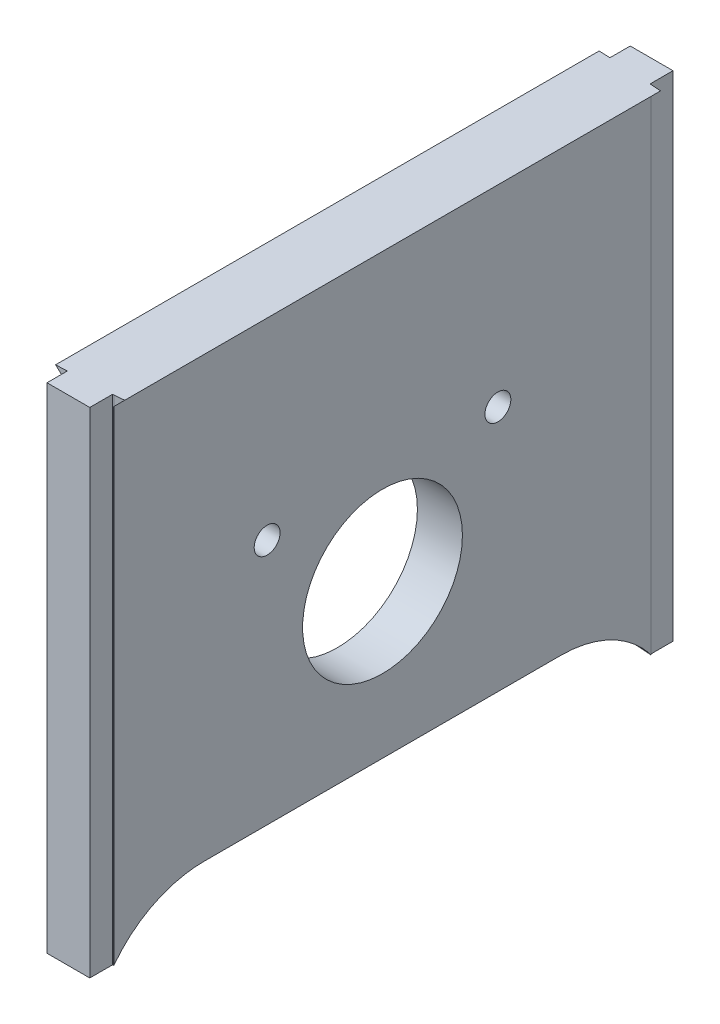
from build123d import *
from build123d.topology import SkipClean

# Parameters (mm, degrees)
SKETCH1_R                = 4.1
SKETCH1_R_2              = 1.15
BOSS_EXTRUDE1_DEPTH      = 3.5
BOSS_EXTRUDE2_DEPTH      = 67.25
CUT_EXTRUDE1_DEPTH       = 94.994268442
SKETCH4_W                = 26.5
SKETCH4_H                = 47.25
CUT_EXTRUDE2_DEPTH       = 3.5
SKETCH6_W                = 31.5
SKETCH6_H                = 52.25
BOSS_EXTRUDE3_DEPTH      = 2
CHAMFER2_SIZE            = 2
SKETCH7_W                = 26.5
SKETCH7_H                = 47.25
CUT_EXTRUDE3_DEPTH       = 0.8
CUT_EXTRUDE4_REACH       = 97.271
SKETCH8_W                = 21.401119101
SKETCH8_H                = 6.5
CUT_EXTRUDE5_REACH       = 97.271
SKETCH9_R                = 7.1
BOSS_EXTRUDE4_DEPTH      = 3.5
SKETCH11_W               = 4
SKETCH11_H               = 49.717369648
BOSS_EXTRUDE5_DEPTH      = 40
SKETCH12_R               = 7.1
CUT_EXTRUDE6_DEPTH       = 10
CHAMFER3_SIZE            = 1
CHAMFER4_SIZE            = 1
SKETCH13_R               = 9
SKETCH13_R_2             = 5.5
BOSS_EXTRUDE6_DEPTH      = 1.5
SKETCH16_R               = 9
BOSS_EXTRUDE7_DEPTH      = 1
FILLET2_R                = 1
SKETCH18_R               = 9
SKETCH18_R_2             = 7.1
BOSS_EXTRUDE8_DEPTH      = 0.5
CHAMFER5_SIZE            = 0.5
BOSS_EXTRUDE9_DEPTH      = 40.5
CUT_EXTRUDE8_REACH       = 129.458
CHAMFER6_SIZE            = 1.5
CUT_EXTRUDE9_REACH       = 129.458
SKETCH20_R               = 7.1
SKETCH21_R               = 1.5
BOSS_EXTRUDE10_DEPTH     = 3.5
CUT_EXTRUDE10_REACH      = 129.458
SKETCH22_R               = 3.75
SKETCH23_R               = 1.15
BOSS_EXTRUDE11_DEPTH     = 1.82
BOSS_EXTRUDE12_START     = 2.65
SKETCH24_W               = 5
SKETCH24_H               = 15.934069979
SKETCH24_R               = 1.15
BOSS_EXTRUDE12_DEPTH     = 2.65
CUT_EXTRUDE11_REACH      = 118.561
SKETCH25_R               = 1.15
SKETCH26_R               = 13.375
CUT_EXTRUDE12_DEPTH      = 3.3
SKETCH27_R               = 5
BOSS_EXTRUDE13_DEPTH     = 1
FILLET7_R                = 0.75
SKETCH28_R               = 8
SKETCH28_R_2             = 4.1
BOSS_EXTRUDE14_DEPTH     = 1.5
SKETCH29_R               = 8
SKETCH29_R_2             = 4.1
BOSS_EXTRUDE15_DEPTH     = 8.5
CUT_EXTRUDE13_DEPTH      = 15
CUT_EXTRUDE13_DEPTH_BACK = 127.447026853
SKETCH30_R               = 1.125
SKETCH31_R               = 7.1
BOSS_EXTRUDE16_DEPTH     = 0.5
CHAMFER7_SIZE            = 0.5
CHAMFER7_OF_MIRROR5_SIZE = 0.5
FILLET8_R                = 2.5
CUT_EXTRUDE14_DEPTH      = 10
CUT_EXTRUDE14_DEPTH_BACK = 10
SKETCH32_W               = 30.5
SKETCH32_H               = 23.22
FILLET9_R                = 5
CUT_EXTRUDE15_DEPTH      = 2
SKETCH34_R               = 2.25
CUT_EXTRUDE16_DEPTH      = 1.5
CUT_EXTRUDE17_DEPTH      = 133.651095359
CUT_EXTRUDE17_DEPTH_BACK = 2
SKETCH35_W               = 15
SKETCH35_H               = 21.75
FILLET10_R               = 1
FILLET11_R               = 1
SKETCH36_R               = 1.15
CUT_EXTRUDE18_DEPTH      = 127.188133357
CUT_EXTRUDE24_DEPTH      = 107.374679788
CUT_EXTRUDE24_DEPTH_BACK = 107.374679788
SKETCH39_W               = 129.097632358
SKETCH39_H               = 90.611923089
CUT_EXTRUDE25_DEPTH      = 69.011167635
CUT_EXTRUDE25_DEPTH_BACK = 3.5
SKETCH40_W               = 54.925006482
SKETCH40_H               = 71.748882342
CUT_EXTRUDE26_DEPTH      = 66.567961717
FILLET12_R               = 10
CUT_EXTRUDE27_DEPTH      = 0.1
FILLET13_R               = 0.02


# Some blends are built 0.0001 mm under size
with BuildPart() as part:
    # Sketch1 → Boss-Extrude1 (new body)
    with BuildSketch(Plane(origin=(0, 0, 0), x_dir=(0, 0, -1), z_dir=(1, 0, 0))):
        with BuildLine():
            Line((-17.25, 0), (-17.25, -67.25))
            Line((-17.25, -67.25), (17.25, -67.25))
            Line((17.25, -67.25), (17.25, 0))
            ThreePointArc((17.25, 0), (0, 17.25), (-17.25, 0))
        make_face()
        Circle(SKETCH1_R, mode=Mode.SUBTRACT)
        with Locations((0, 8.125)):
            Circle(SKETCH1_R_2, mode=Mode.SUBTRACT)
        with Locations((8.125, 0)):
            Circle(SKETCH1_R_2, mode=Mode.SUBTRACT)
        with Locations((-8.125, 0)):
            Circle(SKETCH1_R_2, mode=Mode.SUBTRACT)
        with Locations((0, -8.125)):
            Circle(SKETCH1_R_2, mode=Mode.SUBTRACT)
    boss_extrude1 = extrude(amount=BOSS_EXTRUDE1_DEPTH)

    # Sketch2 → Boss-Extrude2 (add)
    with BuildSketch(Plane(origin=(0, 0, 0), x_dir=(-1, 0, 0), z_dir=(0, -1, 0))):
        with BuildLine():
            Line((-59.4, -17.25), (-59.4, -20.25))
            ThreePointArc((-59.4, -20.25), (-58.989582055, -21.693064324), (-58.079872716, -22.886088403))
            ThreePointArc((-58.079872716, -22.886088403), (-54.454905265, -25.285822393), (-50.289145158, -26.529025904))
            ThreePointArc((-50.289145158, -26.529025904), (-40.020812264, -27.631788405), (-29.7, -28))
            ThreePointArc((-29.7, -28), (-19.379187736, -27.631788405), (-9.110854842, -26.529025904))
            ThreePointArc((-9.110854842, -26.529025904), (-4.945094735, -25.285822393), (-1.320127284, -22.886088403))
            ThreePointArc((-1.320127284, -22.886088403), (-0.410417945, -21.693064324), (0, -20.25))
            Line((0, -20.25), (0, -17.25))
            Line((0, -17.25), (-3.5, -17.25))
            Line((-3.5, -17.25), (-3.735903774, -19.954735321))
            ThreePointArc((-3.735903774, -19.954735321), (-3.770225997, -20.037754997), (-3.828562802, -20.106071165))
            ThreePointArc((-3.828562802, -20.106071165), (-6.407189742, -21.835001354), (-9.364778442, -22.779027613))
            ThreePointArc((-9.364778442, -22.779027613), (-19.505740765, -23.883479028), (-29.7, -24.2522722))
            ThreePointArc((-29.7, -24.2522722), (-39.894259235, -23.883479028), (-50.035221558, -22.779027613))
            ThreePointArc((-50.035221558, -22.779027613), (-52.992810258, -21.835001354), (-55.571437198, -20.106071165))
            ThreePointArc((-55.571437198, -20.106071165), (-55.629774003, -20.037754997), (-55.664096226, -19.954735321))
            Line((-55.664096226, -19.954735321), (-55.9, -17.25))
            Line((-55.9, -17.25), (-59.4, -17.25))
        make_face()
    boss_extrude2 = extrude(amount=BOSS_EXTRUDE2_DEPTH)

    # Mirror2: Boss-Extrude1 across plane
    add(boss_extrude1.mirror(Plane.ZY.offset(-29.7)))

    # Sketch3 → Cut-Extrude1 (cut, through all)
    with BuildSketch(Plane.ZY):
        Polygon((17.25, 0), (32.748612496, -8.948128097), (32.748612496, 0), align=None)
    cut_extrude1 = extrude(amount=-CUT_EXTRUDE1_DEPTH, mode=Mode.SUBTRACT)

    # Mirror3: Boss-Extrude2, Cut-Extrude1 across plane
    add(boss_extrude2.mirror(Plane(origin=(0, 0, 0), x_dir=(1, 0, 0), z_dir=(0, 0, -1))))
    add(cut_extrude1.mirror(Plane(origin=(0, 0, 0), x_dir=(1, 0, 0), z_dir=(0, 0, -1))), mode=Mode.SUBTRACT)

    # Sketch4 → Cut-Extrude2 (cut)
    with BuildSketch(Plane.ZY):
        with Locations((0, -37.125)):
            Rectangle(SKETCH4_W, SKETCH4_H)
    extrude(amount=-CUT_EXTRUDE2_DEPTH, mode=Mode.SUBTRACT)

    # Sketch6 → Boss-Extrude3 (add)
    with BuildSketch(Plane.ZY):
        with Locations((0, -37.125)):
            Rectangle(SKETCH6_W, SKETCH6_H)
    extrude(amount=BOSS_EXTRUDE3_DEPTH)

    # Chamfer2
    chamfer2_edges = [part.edges().sort_by_distance(p)[0] for p in [
        (-2, -63.25, 0),
        (-2, -37.125, 15.75),
        (-2, -37.125, -15.75),
        (-2, -11, 0),
    ]]
    chamfer(chamfer2_edges, length=CHAMFER2_SIZE - 0.0001)  # a hair under: the kernel refuses the full size

    # Sketch7 → Cut-Extrude3 (cut)
    with BuildSketch(Plane(origin=(0, 0, 0), x_dir=(0, 0, -1), z_dir=(1, 0, 0))):
        with Locations((0, -37.125)):
            Rectangle(SKETCH7_W, SKETCH7_H)
    extrude(amount=-CUT_EXTRUDE3_DEPTH, mode=Mode.SUBTRACT)

    # Sketch8 → Cut-Extrude4 (cut, up to next)
    with BuildSketch(Plane.ZY.offset(2), mode=Mode.PRIVATE) as cut_extrude4_sk1:
        with Locations((0.049440449, -35.5)):
            Rectangle(SKETCH8_W, SKETCH8_H)
    cut_extrude4_tool1 = extrude(cut_extrude4_sk1.sketch, amount=-CUT_EXTRUDE4_REACH, mode=Mode.PRIVATE) & part.part
    add(cut_extrude4_tool1.solids().sort_by_distance((-2, -35.5, 0.04944))[0], mode=Mode.SUBTRACT)

    # Sketch9 → Cut-Extrude5 (cut, up to next)
    with BuildSketch(Plane(origin=(59.4, 0, 0), x_dir=(0, 0, -1), z_dir=(1, 0, 0)), mode=Mode.PRIVATE) as cut_extrude5_sk1:
        with Locations((0, -49.64)):
            Circle(SKETCH9_R)
    cut_extrude5_tool1 = extrude(cut_extrude5_sk1.sketch, amount=-CUT_EXTRUDE5_REACH, mode=Mode.PRIVATE) & part.part
    add(cut_extrude5_tool1.solids().sort_by_distance((59.4, -49.64, 0))[0], mode=Mode.SUBTRACT)

    # Sketch10 → Boss-Extrude4 (add)
    with BuildSketch(Plane(origin=(0, -19.75, 0), x_dir=(-1, 0, 0), z_dir=(0, -1, 0))):
        with BuildLine():
            Line((-55.664096226, -19.954735321), (-55.9, -17.25))
            Line((-55.9, -17.25), (-55.9, 17.25))
            Line((-55.9, 17.25), (-55.664096226, 19.954735321))
            ThreePointArc((-55.664096226, 19.954735321), (-55.629774003, 20.037754997), (-55.571437198, 20.106071165))
            ThreePointArc((-55.571437198, 20.106071165), (-52.992810258, 21.835001354), (-50.035221558, 22.779027613))
            ThreePointArc((-50.035221558, 22.779027613), (-29.7, 24.2522722), (-9.364778442, 22.779027613))
            ThreePointArc((-9.364778442, 22.779027613), (-6.407189742, 21.835001354), (-3.828562802, 20.106071165))
            ThreePointArc((-3.828562802, 20.106071165), (-3.770225997, 20.037754997), (-3.735903774, 19.954735321))
            Line((-3.735903774, 19.954735321), (-3.5, 17.25))
            Line((-3.5, 17.25), (-3.5, 12.559999042))
            Line((-3.5, 12.559999042), (-34.519998723, 12.559999042))
            Line((-34.519998723, 12.559999042), (-34.519998723, -12.559999407))
            Line((-34.519998723, -12.559999407), (-3.5, -12.559999407))
            Line((-3.5, -12.559999407), (-3.5, -17.25))
            Line((-3.5, -17.25), (-3.735903774, -19.954735321))
            ThreePointArc((-3.735903774, -19.954735321), (-3.770225997, -20.037754997), (-3.828562802, -20.106071165))
            ThreePointArc((-3.828562802, -20.106071165), (-6.407189742, -21.835001354), (-9.364778442, -22.779027613))
            ThreePointArc((-9.364778442, -22.779027613), (-29.7, -24.2522722), (-50.035221558, -22.779027613))
            ThreePointArc((-50.035221558, -22.779027613), (-52.992810258, -21.835001354), (-55.571437198, -20.106071165))
            ThreePointArc((-55.571437198, -20.106071165), (-55.629774003, -20.037754997), (-55.664096226, -19.954735321))
        make_face()
    extrude(amount=BOSS_EXTRUDE4_DEPTH)

    # Sketch11 → Boss-Extrude5 (add)
    with BuildSketch(Plane(origin=(0, -23.25, 0), x_dir=(-1, 0, 0), z_dir=(0, -1, 0))):
        with Locations((-38.07, 0.750293773)):
            Rectangle(SKETCH11_W, SKETCH11_H)
    extrude(amount=BOSS_EXTRUDE5_DEPTH)

    # Sketch12 → Cut-Extrude6 (cut)
    with BuildSketch(Plane(origin=(40.07, 0, 0), x_dir=(0, 0, -1), z_dir=(1, 0, 0))):
        with Locations((0, -49.64)):
            Circle(SKETCH12_R)
    extrude(amount=-CUT_EXTRUDE6_DEPTH, mode=Mode.SUBTRACT)

    # Chamfer3
    chamfer3_edges = [part.edges().sort_by_distance(p)[0] for p in [
        (36.07, -23.25, 0),
    ]]
    chamfer(chamfer3_edges, length=CHAMFER3_SIZE)

    # Chamfer4
    chamfer4_edges = [part.edges().sort_by_distance(p)[0] for p in [
        (40.07, -23.25, 0),
    ]]
    chamfer(chamfer4_edges, length=CHAMFER4_SIZE)

    # Sketch13 → Boss-Extrude6 (add)
    with BuildSketch(Plane(origin=(59.4, 0, 0), x_dir=(0, 0, -1), z_dir=(1, 0, 0))):
        with Locations(Location((0, -49.64, 0), (0, 0, 180))):
            Circle(SKETCH13_R)
        with Locations((0, -49.64)):
            Circle(SKETCH13_R_2, mode=Mode.SUBTRACT)
    extrude(amount=BOSS_EXTRUDE6_DEPTH)

    # Sketch16 → Boss-Extrude7 (add)
    with BuildSketch(Plane(origin=(60.9, 0, 0), x_dir=(0, 0, -1), z_dir=(1, 0, 0))):
        with Locations(Location((0, -49.64, 0), (0, 0, 180))):
            Circle(SKETCH16_R)
    extrude(amount=BOSS_EXTRUDE7_DEPTH)

    # Fillet2
    fillet2_edges = [part.edges().sort_by_distance(p)[0] for p in [
        (61.9, -49.64, -9),
    ]]
    fillet(fillet2_edges, radius=FILLET2_R)

    # Sketch18 → Boss-Extrude8 (add)
    with BuildSketch(Plane.ZY.offset(-55.9)):
        with Locations((0, -49.64)):
            Circle(SKETCH18_R)
        with Locations(Location((0, -49.64, 0), (0, 0, 180))):
            Circle(SKETCH18_R_2, mode=Mode.SUBTRACT)
    extrude(amount=BOSS_EXTRUDE8_DEPTH)

    # Chamfer5
    chamfer5_edges = [part.edges().sort_by_distance(p)[0] for p in [
        (55.9, -49.64, -9),
    ]]
    chamfer(chamfer5_edges, length=CHAMFER5_SIZE - 0.0001)  # a hair under: the kernel refuses the full size

    # Sketch17 → Boss-Extrude9 (add)
    with BuildSketch(Plane(origin=(0, 0, 20.25), x_dir=(-1, 0, 0), z_dir=(0, 0, -1))):
        Polygon((-59.65, -105.91), (-63.15, -105.91), (-63.15, -67.5), (-59.4, -63.75), (-59.4, -67.25), (-55.9, -67.25), (-59.65, -71), align=None)
    boss_extrude9 = extrude(amount=BOSS_EXTRUDE9_DEPTH)

    # Sketch19 → Cut-Extrude8 (cut, up to next)
    with BuildSketch(Plane(origin=(63.15, 0, 0), x_dir=(0, 0, -1), z_dir=(1, 0, 0)), mode=Mode.PRIVATE) as cut_extrude8_sk1:
        with BuildLine():
            ThreePointArc((0, -105.91), (-12.515790027, -100.725790027), (-17.7, -88.21))
            Line((-17.7, -88.21), (-20.25, -85.66))
            Line((-20.25, -85.66), (-20.25, -105.91))
            Line((-20.25, -105.91), (0, -105.91))
        make_face()
    cut_extrude8_tool1 = extrude(cut_extrude8_sk1.sketch, amount=-CUT_EXTRUDE8_REACH, mode=Mode.PRIVATE) & part.part
    # Sketch19 → Cut-Extrude8 (cut, up to next)
    with BuildSketch(Plane(origin=(63.15, 0, 0), x_dir=(0, 0, -1), z_dir=(1, 0, 0)), mode=Mode.PRIVATE) as cut_extrude8_sk2:
        with BuildLine():
            ThreePointArc((17.7, -88.21), (12.515790027, -100.725790027), (0, -105.91))
            Line((0, -105.91), (20.25, -105.91))
            Line((20.25, -105.91), (20.25, -85.66))
            Line((20.25, -85.66), (17.7, -88.21))
        make_face()
    cut_extrude8_tool2 = extrude(cut_extrude8_sk2.sketch, amount=-CUT_EXTRUDE8_REACH, mode=Mode.PRIVATE) & part.part
    cut_extrude8_1 = cut_extrude8_tool1.solids().sort_by_distance((63.15, -99.634492, 15.946502))[0]
    add(cut_extrude8_1, mode=Mode.SUBTRACT)
    cut_extrude8_2 = cut_extrude8_tool2.solids().sort_by_distance((63.15, -99.634492, -15.946502))[0]
    add(cut_extrude8_2, mode=Mode.SUBTRACT)
    cut_extrude8 = cut_extrude8_1 + cut_extrude8_2  # Cut-Extrude8 as one shape, for the pattern or mirror that repeats it

    # Chamfer6
    chamfer6_edges = [part.edges().sort_by_distance(p)[0] for p in [
        (59.4, -49.64, -9),
    ]]
    chamfer(chamfer6_edges, length=CHAMFER6_SIZE - 0.0001)  # a hair under: the kernel refuses the full size

    # Sketch20 → Cut-Extrude9 (cut, up to next)
    with BuildSketch(Plane(origin=(63.15, 0, 0), x_dir=(0, 0, -1), z_dir=(1, 0, 0)), mode=Mode.PRIVATE) as cut_extrude9_sk1:
        with Locations(Location((0, -88.21, 0), (0, 0, 90))):
            Circle(SKETCH20_R)
    cut_extrude9_tool1 = extrude(cut_extrude9_sk1.sketch, amount=-CUT_EXTRUDE9_REACH, mode=Mode.PRIVATE) & part.part
    cut_extrude9 = cut_extrude9_tool1.solids().sort_by_distance((63.15, -88.21, 0))[0]
    add(cut_extrude9, mode=Mode.SUBTRACT)

    # Sketch21 → Boss-Extrude10 (add)
    with BuildSketch(Plane.ZY):
        with Locations((0, 8.125)):
            Circle(SKETCH21_R)
        with Locations((8.125, 0)):
            Circle(SKETCH21_R)
        with Locations((0, -8.125)):
            Circle(SKETCH21_R)
        with Locations((-8.125, 0)):
            Circle(SKETCH21_R)
    extrude(amount=-BOSS_EXTRUDE10_DEPTH)

    # Mirror4: Boss-Extrude9, Cut-Extrude8, Cut-Extrude9 across plane
    add(boss_extrude9.mirror(Plane.ZY.offset(-29.7)))
    add(cut_extrude8.mirror(Plane.ZY.offset(-29.7)), mode=Mode.SUBTRACT)
    add(cut_extrude9.mirror(Plane.ZY.offset(-29.7)), mode=Mode.SUBTRACT)

    # Sketch22 → Cut-Extrude10 (cut, up to next)
    with BuildSketch(Plane.ZY.offset(2), mode=Mode.PRIVATE) as cut_extrude10_sk1:
        with Locations((0, -49.64)):
            Circle(SKETCH22_R)
    cut_extrude10_tool1 = extrude(cut_extrude10_sk1.sketch, amount=-CUT_EXTRUDE10_REACH, mode=Mode.PRIVATE) & part.part
    add(cut_extrude10_tool1.solids().sort_by_distance((-2, -49.64, 0))[0], mode=Mode.SUBTRACT)

    # Sketch23 → Boss-Extrude11 (add)
    with BuildSketch(Plane(origin=(-0.8, 0, 0), x_dir=(0, 0, -1), z_dir=(1, 0, 0))):
        with BuildLine():
            Line((10.8, -38.889999996), (6.999999457, -38.890000068))
            Line((6.999999457, -38.890000068), (6.999996312, -40.653616778))
            ThreePointArc((6.999996312, -40.653616778), (8.489057136, -42.044544733), (9.706479797, -43.678516819))
            Line((9.706479797, -43.678516819), (11.359988862, -43.678515032))
            ThreePointArc((11.359988862, -43.678515032), (11.713588357, -43.532032852), (11.859995379, -43.178403539))
            Line((11.859995379, -43.178403539), (11.86002914, -16.529542904))
            add(Edge.make_bspline(
                [(11.86002914, -16.529542904), (11.860165313, -16.430469267), (11.850209846, -16.333113479), (11.811929636, -16.141528813), (11.783134355, -16.046307589), (11.707972993, -15.864777212), (11.661801756, -15.778752889), (11.553004371, -15.615785201), (11.48982416, -15.538574617), (11.282494862, -15.331229176), (11.115347595, -15.219447642), (10.754781823, -15.069949312), (10.558116563, -15.029804422), (10.360121847, -15.029962825)],
                knots=[0, 0, 0, 0, 0.125, 0.125, 0.25, 0.25, 0.375, 0.375, 0.5, 0.5, 0.75, 0.75, 1, 1, 1, 1], degree=3))
            Line((10.360121847, -15.029962825), (-10.360414785, -15.029965499))
            add(Edge.make_bspline(
                [(-10.360414785, -15.029965499), (-10.459488561, -15.029826786), (-10.556844718, -15.039779883), (-10.748430568, -15.078055492), (-10.843652616, -15.10684852), (-11.025185073, -15.18200551), (-11.111210651, -15.228174695), (-11.274181245, -15.336968247), (-11.351393467, -15.400146655), (-11.558744183, -15.60747118), (-11.670529896, -15.774615995), (-11.820037045, -16.135178663), (-11.86018697, -16.331843248), (-11.860032668, -16.529838302)],
                knots=[0, 0, 0, 0, 0.125, 0.125, 0.25, 0.25, 0.375, 0.375, 0.5, 0.5, 0.75, 0.75, 1, 1, 1, 1], degree=3))
            Line((-11.860032668, -16.529838302), (-11.860001151, -43.178485794))
            ThreePointArc((-11.860001151, -43.178485794), (-11.713562299, -43.532062592), (-11.359992206, -43.678517633))
            Line((-11.359992206, -43.678517633), (-9.706483935, -43.678519702))
            ThreePointArc((-9.706483935, -43.678519702), (-8.489059663, -42.044544533), (-6.999996328, -40.653614235))
            Line((-6.999996328, -40.653614235), (-6.99999946, -38.890000068))
            Line((-6.99999946, -38.890000068), (-10.8, -38.889999996))
            Line((-10.8, -38.889999996), (-10.8, -32.115))
            Line((-10.8, -32.115), (-9.303042913, -32.115))
            Line((-9.303042913, -32.115), (-9.442286694, -31.892101192))
            Line((-9.442286694, -31.892101192), (-9.442286694, -20.936914675))
            ThreePointArc((-9.442286694, -20.936914675), (-9.09081483, -20.088386539), (-8.242286694, -19.736914678))
            Line((-8.242286694, -19.736914678), (8.242286696, -19.736914678))
            ThreePointArc((8.242286696, -19.736914678), (9.090814832, -20.088386541), (9.442286694, -20.936914678))
            Line((9.442286694, -20.936914678), (9.442286694, -31.892101192))
            Line((9.442286694, -31.892101192), (9.303042913, -32.115))
            Line((9.303042913, -32.115), (10.8, -32.115))
            Line((10.8, -32.115), (10.8, -38.889999996))
        make_face()
        with Locations(Location((-10.25, -16.89, 0), (0, 0, 180))):
            Circle(SKETCH23_R, mode=Mode.SUBTRACT)
        with Locations(Location((10.25, -16.89, 0), (0, 0, 180))):
            Circle(SKETCH23_R, mode=Mode.SUBTRACT)
        with Locations(Location((10.25, -41.34, 0), (0, 0, 180))):
            Circle(SKETCH23_R, mode=Mode.SUBTRACT)
        with Locations(Location((-10.25, -41.34, 0), (0, 0, 180))):
            Circle(SKETCH23_R, mode=Mode.SUBTRACT)
    extrude(amount=BOSS_EXTRUDE11_DEPTH)

    # Sketch24 → Boss-Extrude12 (add)
    # profile 1 of 2: a face of its own
    with BuildSketch(Plane.ZY.offset(-36.07).offset(BOSS_EXTRUDE12_START)):
        with Locations((-10.5, -37.242079847)):
            Rectangle(SKETCH24_W, SKETCH24_H)
        with Locations((-10.25, -41.34)):
            Circle(SKETCH24_R, mode=Mode.SUBTRACT)
    # profile 2 of 2: a face of its own
    with BuildSketch(Plane.ZY.offset(-36.07).offset(BOSS_EXTRUDE12_START)):
        with Locations((10.5, -37.242079847)):
            Rectangle(SKETCH24_W, SKETCH24_H)
        with Locations((10.25, -41.34)):
            Circle(SKETCH24_R, mode=Mode.SUBTRACT)
    extrude(amount=-BOSS_EXTRUDE12_DEPTH)

    # Sketch25 → Cut-Extrude11 (cut, up to next)
    with BuildSketch(Plane.ZY.offset(-36.07), mode=Mode.PRIVATE) as cut_extrude11_sk1:
        with Locations((10.25, -41.34)):
            Circle(SKETCH25_R)
    cut_extrude11_tool1 = extrude(cut_extrude11_sk1.sketch, amount=-CUT_EXTRUDE11_REACH, mode=Mode.PRIVATE) & part.part
    # Sketch25 → Cut-Extrude11 (cut, up to next)
    with BuildSketch(Plane.ZY.offset(-36.07), mode=Mode.PRIVATE) as cut_extrude11_sk2:
        with Locations((-10.25, -41.34)):
            Circle(SKETCH25_R)
    cut_extrude11_tool2 = extrude(cut_extrude11_sk2.sketch, amount=-CUT_EXTRUDE11_REACH, mode=Mode.PRIVATE) & part.part
    add(cut_extrude11_tool1.solids().sort_by_distance((36.07, -41.34, 10.25))[0], mode=Mode.SUBTRACT)
    add(cut_extrude11_tool2.solids().sort_by_distance((36.07, -41.34, -10.25))[0], mode=Mode.SUBTRACT)

    # Sketch26 → Cut-Extrude12 (cut)
    with BuildSketch(Plane.ZY):
        Circle(SKETCH26_R)
    extrude(amount=CUT_EXTRUDE12_DEPTH, mode=Mode.SUBTRACT)

    # Sketch27 → Boss-Extrude13 (add)
    with BuildSketch(Plane.ZY.offset(2)):
        with Locations((0, -49.64)):
            Circle(SKETCH27_R)
    extrude(amount=BOSS_EXTRUDE13_DEPTH)

    # Fillet7
    fillet7_edges = [part.edges().sort_by_distance(p)[0] for p in [
        (-3, -49.64, -5),
    ]]
    fillet(fillet7_edges, radius=FILLET7_R)

    # Sketch28 → Boss-Extrude14 (add)
    with BuildSketch(Plane(origin=(3.5, 0, 0), x_dir=(0, 0, -1), z_dir=(1, 0, 0))):
        Circle(SKETCH28_R)
        Circle(SKETCH28_R_2, mode=Mode.SUBTRACT)
    extrude(amount=BOSS_EXTRUDE14_DEPTH)

    # Sketch29 → Boss-Extrude15 (add)
    with BuildSketch(Plane(origin=(5, 0, 0), x_dir=(0, 0, -1), z_dir=(1, 0, 0))):
        Circle(SKETCH29_R)
        Circle(SKETCH29_R_2, mode=Mode.SUBTRACT)
    extrude(amount=BOSS_EXTRUDE15_DEPTH)

    # Sketch30 → Cut-Extrude13 (cut, two sides: drawn at the far end of the back side and taken through both)
    with BuildSketch(Plane(origin=(0, 0, 0), x_dir=(-1, 0, 0), z_dir=(0, -1, 0)).offset(-CUT_EXTRUDE13_DEPTH_BACK)):
        with Locations(Location((-8.5, 0, 0), (0, 0, 270))):
            Circle(SKETCH30_R)
    extrude(amount=CUT_EXTRUDE13_DEPTH + CUT_EXTRUDE13_DEPTH_BACK, mode=Mode.SUBTRACT)

    # Sketch31 → Boss-Extrude16 (add)
    with SkipClean():  # the faces are left unmerged after this step: merging them gives an invalid solid
        with BuildSketch(Plane.ZY.offset(3.75)):
            with BuildLine():
                Line((-20.25, -67.5), (-20.25, -85.66))
                Line((-20.25, -85.66), (-17.7, -88.21))
                ThreePointArc((-17.7, -88.21), (0, -105.91), (17.7, -88.21))
                Line((17.7, -88.21), (20.25, -85.66))
                Line((20.25, -85.66), (20.25, -67.5))
                Line((20.25, -67.5), (-20.25, -67.5))
            make_face()
            with Locations(Location((0, -88.21, 0), (0, 0, 90))):
                Circle(SKETCH31_R, mode=Mode.SUBTRACT)
        boss_extrude16 = extrude(amount=BOSS_EXTRUDE16_DEPTH)

    # Chamfer7
    chamfer7_edges = [part.edges().sort_by_distance(p)[0] for p in [
        (-4.25, -67.5, 0),
    ]]
    chamfer(chamfer7_edges, length=CHAMFER7_SIZE - 0.0001)  # a hair under: the kernel refuses the full size

    # Mirror5: Boss-Extrude16 across plane
    add(boss_extrude16.mirror(Plane(origin=(29.7, 0, 0), x_dir=(0, 0, 1), z_dir=(1, 0, 0))))

    # Chamfer7 of Mirror5
    chamfer7_of_mirror5_edges = [part.edges().sort_by_distance(p)[0] for p in [
        (63.65, -67.5, 0),
    ]]
    chamfer(chamfer7_of_mirror5_edges, length=CHAMFER7_OF_MIRROR5_SIZE - 0.0001)  # a hair under: the kernel refuses the full size

    # Fillet8
    # the kernel refuses this fillet: 2.5 mm, written as the material it adds along each edge
    with BuildSketch(Plane(origin=(59.65, -71, 20.25), x_dir=(0, -1, 0), z_dir=(0, 0, -1)), Plane(origin=(-0.25, -71, 20.25), x_dir=(0.7071067811865557, 0.7071067811865394, 0), z_dir=(0, 0, -1))) as fillet8_piece_1:
        with BuildLine():
            CenterArc((FILLET8_R * 0.414213562373, FILLET8_R), FILLET8_R, 225, 45)
            Line((-FILLET8_R * 0.292893218813, FILLET8_R * 0.292893218813), (0, 0))
            Line((0, 0), (FILLET8_R * 0.414213562373, 0))
        make_face()
    extrude(amount=40.5)
    # the kernel refuses this fillet: 2.5 mm, written as the material it takes off along each edge
    with BuildSketch(Plane(origin=(-4.25, -67.9999, 22.838834765), x_dir=(0, -1, 0), z_dir=(0, 0, -1))) as fillet8_2_piece_1:
        with BuildLine():
            CenterArc((FILLET8_R * 0.414213562373, -FILLET8_R), FILLET8_R, 90, 45)
            Line((-FILLET8_R * 0.292893218813, -FILLET8_R * 0.292893218813), (0, 0))
            Line((0, 0), (FILLET8_R * 0.414213562373, 0))
        make_face()
    extrude(amount=45.67766953, mode=Mode.SUBTRACT)
    with BuildSketch(Plane(origin=(63.65, -67.9999, 22.838834765), x_dir=(0, -1, 0), z_dir=(0, 0, -1))) as fillet8_2_piece_2:
        with BuildLine():
            CenterArc((FILLET8_R * 0.414213562373, FILLET8_R), FILLET8_R, 225, 45)
            Line((-FILLET8_R * 0.292893218813, FILLET8_R * 0.292893218813), (0, 0))
            Line((0, 0), (FILLET8_R * 0.414213562373, 0))
        make_face()
    extrude(amount=45.67766953, mode=Mode.SUBTRACT)

    # Sketch32 → Cut-Extrude14 (cut, two sides: drawn at the far end of the back side and taken through both)
    with BuildSketch(Plane(origin=(59.4, 0, 0), x_dir=(0, 0, -1), z_dir=(1, 0, 0)).offset(-CUT_EXTRUDE14_DEPTH_BACK)):
        with Locations((0, -49.64)):
            Rectangle(SKETCH32_W, SKETCH32_H)
    extrude(amount=CUT_EXTRUDE14_DEPTH + CUT_EXTRUDE14_DEPTH_BACK, mode=Mode.SUBTRACT)

    # Fillet9
    fillet9_edges = [part.edges().sort_by_distance(p)[0] for p in [
        (57.65, -38.03, 15.25),
        (57.65, -61.25, 15.25),
        (57.65, -61.25, -15.25),
        (57.65, -38.03, -15.25),
    ]]
    fillet(fillet9_edges, radius=FILLET9_R)

    # Sketch33 → Cut-Extrude15 (cut)
    with BuildSketch(Plane(origin=(59.4, 0, 0), x_dir=(0, 0, -1), z_dir=(1, 0, 0))):
        with BuildLine():
            Line((-18.25, -56.25), (-16.75, -56.25))
            Line((-16.75, -56.25), (-16.75, -43.03))
            ThreePointArc((-16.75, -43.03), (-14.846194078, -38.433805922), (-10.25, -36.53))
            Line((-10.25, -36.53), (10.25, -36.53))
            ThreePointArc((10.25, -36.53), (14.846194078, -38.433805922), (16.75, -43.03))
            Line((16.75, -43.03), (16.75, -56.25))
            Line((16.75, -56.25), (18.25, -56.25))
            Line((18.25, -56.25), (18.25, -43.03))
            ThreePointArc((18.25, -43.03), (15.906854249, -37.373145751), (10.25, -35.03))
            Line((10.25, -35.03), (-10.25, -35.03))
            ThreePointArc((-10.25, -35.03), (-15.906854249, -37.373145751), (-18.25, -43.03))
            Line((-18.25, -43.03), (-18.25, -56.25))
        make_face()
    extrude(amount=-CUT_EXTRUDE15_DEPTH, mode=Mode.SUBTRACT)

    # Sketch34 → Cut-Extrude16 (cut)
    with BuildSketch(Plane(origin=(59.4, 0, 0), x_dir=(0, 0, -1), z_dir=(1, 0, 0))):
        with Locations((0, 8.125)):
            Circle(SKETCH34_R)
        with Locations((8.125, 0)):
            Circle(SKETCH34_R)
        with Locations((0, -8.125)):
            Circle(SKETCH34_R)
        with Locations((-8.125, 0)):
            Circle(SKETCH34_R)
    extrude(amount=-CUT_EXTRUDE16_DEPTH, mode=Mode.SUBTRACT)

    # Sketch35 → Cut-Extrude17 (cut, two sides: drawn at the far end of the back side and taken through both)
    with BuildSketch(Plane.XY.offset(20.25).offset(-CUT_EXTRUDE17_DEPTH_BACK)):
        with Locations((48.15, -8.875)):
            Rectangle(SKETCH35_W, SKETCH35_H)
    extrude(amount=CUT_EXTRUDE17_DEPTH + CUT_EXTRUDE17_DEPTH_BACK, mode=Mode.SUBTRACT)

    # Fillet10
    fillet10_edges = [part.edges().sort_by_distance(p)[0] for p in [
        (40.65, -12.858590015, 27.585458991),
        (55.65, -12.013821491, 24.659094982),
    ]]
    fillet(fillet10_edges, radius=FILLET10_R)

    # Fillet11
    fillet11_edges = [part.edges().sort_by_distance(p)[0] for p in [
        (40.65, -11.773525783, 23.826686232),
    ]]
    fillet(fillet11_edges, radius=FILLET11_R)

    # Sketch36 → Cut-Extrude18 (cut, through all)
    with BuildSketch(Plane(origin=(1.02, 0, 0), x_dir=(0, 0, -1), z_dir=(1, 0, 0))):
        with Locations(Location((10.25, -41.34, 0), (0, 0, 180))):
            Circle(SKETCH36_R)
        with Locations(Location((10.25, -16.89, 0), (0, 0, 180))):
            Circle(SKETCH36_R)
        with Locations(Location((-10.25, -16.89, 0), (0, 0, 180))):
            Circle(SKETCH36_R)
        with Locations(Location((-10.25, -41.34, 0), (0, 0, 180))):
            Circle(SKETCH36_R)
    extrude(amount=-CUT_EXTRUDE18_DEPTH, mode=Mode.SUBTRACT)

    # Sketch39 → Cut-Extrude24 (cut, two sides: drawn at the far end of the back side and taken through both)
    with BuildSketch(Plane.XZ.offset(63.25).offset(-CUT_EXTRUDE24_DEPTH_BACK)):
        with Locations((23.881285679, 9.548177142)):
            Rectangle(SKETCH39_W, SKETCH39_H)
        with BuildLine():
            Line((31.935379733, -24.234561595), (31.935379733, 24.234561595))
            ThreePointArc((31.935379733, 24.234561595), (34.003152314, 24.186630775), (36.07, 24.108391051))
            Line((36.07, 24.108391051), (36.07, 26.0079354))
            Line((36.07, 26.0079354), (40.07, 26.0079354))
            Line((40.07, 26.0079354), (40.07, 23.870636644))
            ThreePointArc((40.07, 23.870636644), (40.607246532, 23.830008061), (41.144333988, 23.787328054))
            Line((41.144333988, 23.787328054), (41.144333988, -23.787328054))
            ThreePointArc((41.144333988, -23.787328054), (40.607246532, -23.830008061), (40.07, -23.870636644))
            Line((40.07, -23.870636644), (40.07, -26.0079354))
            Line((40.07, -26.0079354), (36.07, -26.0079354))
            Line((36.07, -26.0079354), (36.07, -24.108391051))
            ThreePointArc((36.07, -24.108391051), (34.003152314, -24.186630775), (31.935379733, -24.234561595))
        make_face(mode=Mode.SUBTRACT)
    extrude(amount=CUT_EXTRUDE24_DEPTH + CUT_EXTRUDE24_DEPTH_BACK, mode=Mode.SUBTRACT)

    # Sketch40 → Cut-Extrude25 (cut, two sides: drawn at the far end of the back side and taken through both)
    with BuildSketch(Plane(origin=(0, -19.75, 0), x_dir=(1, 0, 0), z_dir=(0, 1, 0)).offset(-CUT_EXTRUDE25_DEPTH_BACK)):
        with Locations((39.101577686, 6.308953447)):
            Rectangle(SKETCH40_W, SKETCH40_H)
    extrude(amount=CUT_EXTRUDE25_DEPTH + CUT_EXTRUDE25_DEPTH_BACK, mode=Mode.SUBTRACT)

    # Sketch41 → Cut-Extrude26 (cut, through all)
    with BuildSketch(Plane(origin=(0, -23.25, 0), x_dir=(1, 0, 0), z_dir=(0, 1, 0))):
        Polygon((36.07, -24.108391051), (36.17, -24.103871284), (36.17, -25.9079354), (39.97, -25.9079354), (39.97, -23.878007003), (40.07, -23.870636644), (40.07, -26.0079354), (36.07, -26.0079354), align=None)
        Polygon((36.07, 24.108391051), (36.17, 24.103871284), (36.17, 25.9079354), (39.97, 25.9079354), (39.97, 23.878007003), (40.07, 23.870636644), (40.07, 26.0079354), (36.07, 26.0079354), align=None)
    extrude(amount=-CUT_EXTRUDE26_DEPTH, mode=Mode.SUBTRACT)

    # Fillet12
    # the kernel refuses this fillet: 10 mm, written as the material it adds along each edge
    with BuildSketch(Plane(origin=(29.7, -63.25, -116.828064758), x_dir=(-0.09644613300635278, 0, 0.9953382055503148), z_dir=(-0.9953382055503148, 0, -0.09644613300635278))) as fillet12_piece_1_section:
        with BuildLine():
            CenterArc((133.080336958, -10), FILLET12_R, 36.869897646, 53.130102354)
            Line((133.080336958, 0), (141.080336958, 0))
            Line((141.080336958, 0), (141.080336958, -4))
        make_face()
    fillet12_piece_1 = revolve(axis=Axis((29.7, -63.25, -116.828064758), (0, 1, 0)), revolution_arc=17.87227661, mode=Mode.PRIVATE)
    fillet12_piece_1 = split(fillet12_piece_1, bisect_by=Plane(origin=(40.07, -64.287839546, 20.472574235), z_dir=(-1, 0, 0)), keep=Keep.TOP, mode=Mode.PRIVATE)
    fillet12_piece_1 = split(fillet12_piece_1, bisect_by=Plane(origin=(36.07, -64.287839546, 20.472574235), z_dir=(1, 0, 0)), keep=Keep.TOP, mode=Mode.PRIVATE)
    add(fillet12_piece_1)
    with BuildSketch(Plane(origin=(29.7, -63.25, 116.828064758), x_dir=(0.21367351936506734, 0, -0.9769051269811957), z_dir=(0.9769051269811957, 0, 0.21367351936506734))) as fillet12_piece_2_section:
        with BuildLine():
            CenterArc((133.080336958, -10), FILLET12_R, 36.869897646, 53.130102354)
            Line((141.080336958, -4), (141.080336958, 0))
            Line((141.080336958, 0), (133.080336958, 0))
        make_face()
    fillet12_piece_2 = revolve(axis=Axis((29.7, -63.25, 116.828064758), (0, 1, 0)), revolution_arc=17.87227661, mode=Mode.PRIVATE)
    fillet12_piece_2 = split(fillet12_piece_2, bisect_by=Plane(origin=(40.07, -64.287839546, -20.472574235), z_dir=(-1, 0, 0)), keep=Keep.TOP, mode=Mode.PRIVATE)
    fillet12_piece_2 = split(fillet12_piece_2, bisect_by=Plane(origin=(36.07, -64.287839546, -20.472574235), z_dir=(1, 0, 0)), keep=Keep.TOP, mode=Mode.PRIVATE)
    add(fillet12_piece_2)

    # Sketch42 → Cut-Extrude27 (cut)
    with BuildSketch(Plane(origin=(0, -23.25, 0), x_dir=(1, 0, 0), z_dir=(0, 1, 0))):
        with BuildLine():
            Line((36.07, -24.108391051), (36.17, -24.103871284))
            Line((36.17, -24.103871284), (36.17, -25.9079354))
            Line((36.17, -25.9079354), (39.97, -25.9079354))
            Line((39.97, -25.9079354), (39.97, -23.878007003))
            Line((39.97, -23.878007003), (40.07, -23.870636644))
            ThreePointArc((40.07, -23.870636644), (40.570068675, -23.832886053), (41.07, -23.793358134))
            Line((41.07, -23.793358134), (41.07, 23.793358134))
            ThreePointArc((41.07, 23.793358134), (40.570068675, 23.832886053), (40.07, 23.870636644))
            Line((40.07, 23.870636644), (39.97, 23.878007003))
            Line((39.97, 23.878007003), (39.97, 25.9079354))
            Line((39.97, 25.9079354), (36.17, 25.9079354))
            Line((36.17, 25.9079354), (36.17, 24.103871284))
            Line((36.17, 24.103871284), (36.07, 24.108391051))
            ThreePointArc((36.07, 24.108391051), (35.570036929, 24.130099754), (35.07, 24.150034875))
            Line((35.07, 24.150034875), (35.07, -24.150034875))
            ThreePointArc((35.07, -24.150034875), (35.570036929, -24.130099754), (36.07, -24.108391051))
        make_face()
    extrude(amount=-CUT_EXTRUDE27_DEPTH, mode=Mode.SUBTRACT)

    # Fillet13
    fillet13_edges = [part.edges().sort_by_distance(p)[0] for p in [
        (40.07, -45.75, 23.870636644),
        (36.07, -45.75, 24.108391051),
        (36.07, -45.75, -24.108391051),
        (40.07, -45.75, -23.870636644),
    ]]
    fillet(fillet13_edges, radius=FILLET13_R)


solid = part.part
